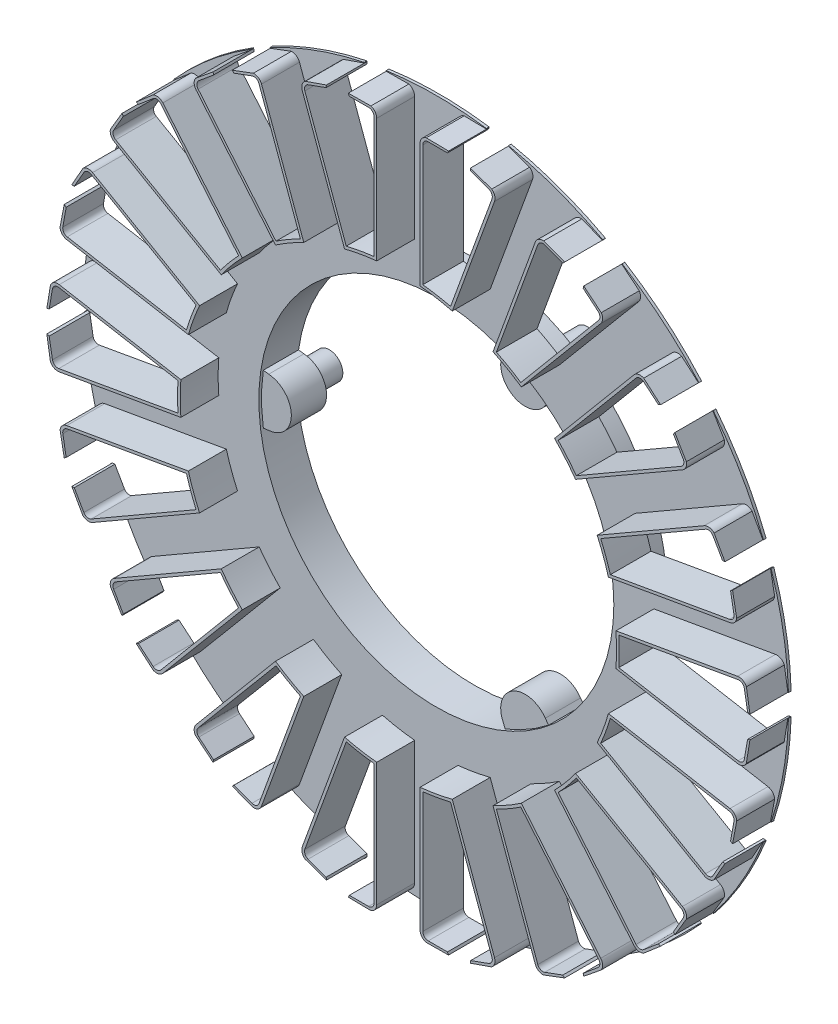
from build123d import *
from build123d.topology import SkipClean

# Parameters (mm, degrees)
SKETCH1_R            = 32.75
BOSS_EXTRUDE2_DEPTH  = 0.5
BOSS_EXTRUDE4_DEPTH  = 7
BOSS_EXTRUDE8_DEPTH  = 7
BOSS_EXTRUDE10_START = 6.5
SKETCH10_R           = 35.55
BOSS_EXTRUDE10_DEPTH = 6.5
SKETCH11_R           = 2.5
BOSS_EXTRUDE11_DEPTH = 5
SKETCH12_R           = 1.25
CUT_EXTRUDE1_DEPTH   = 10


with BuildPart() as part:
    # Sketch1 → Boss-Extrude2 (new body)
    with BuildSketch(Plane.XY):
        with BuildLine():
            Line((-4.5, 40.500771598), (-4.5, 62.839847339))
            ThreePointArc((-4.5, 62.839847339), (-4.793512909, 63.547573268), (-5.50175198, 63.839845805))
            Line((-5.50175198, 63.839845805), (-9.050000307, 63.833629334))
            Line((-9.050000307, 63.833629334), (-9.25, 64.233278938))
            Line((-9.25, 64.233278938), (-9.25, 64.338460504))
            ThreePointArc((-9.25, 64.338460504), (0, 65), (9.25, 64.338460504))
            Line((9.25, 64.338460504), (9.25, 64.233278938))
            Line((9.25, 64.233278938), (9.050000307, 63.833629334))
            Line((9.050000307, 63.833629334), (5.50175198, 63.839845805))
            ThreePointArc((5.50175198, 63.839845805), (4.793512909, 63.547573268), (4.5, 62.839847339))
            Line((4.5, 62.839847339), (4.5, 40.500771598))
            ThreePointArc((4.5, 40.500771598), (7.07616324, 40.130915935), (9.623462913, 39.597366851))
            Line((9.623462913, 39.597366851), (17.2638768, 60.589231481))
            ThreePointArc((17.2638768, 60.589231481), (17.230121409, 61.354663641), (16.664557475, 61.871542016))
            Line((16.664557475, 61.871542016), (13.328168547, 63.079272845))
            Line((13.328168547, 63.079272845), (13.276918526, 63.523224553))
            Line((13.276918526, 63.523224553), (13.312892741, 63.622062894))
            ThreePointArc((13.312892741, 63.622062894), (22.231309316, 61.080020351), (30.697206225, 57.294690242))
            Line((30.697206225, 57.294690242), (30.661232011, 57.195851901))
            Line((30.661232011, 57.195851901), (30.33660556, 56.888708041))
            Line((30.33660556, 56.888708041), (27.004468949, 58.108122014))
            ThreePointArc((27.004468949, 58.108122014), (26.238978825, 58.075707697), (25.721110387, 57.511050191))
            Line((25.721110387, 57.511050191), (18.0806965, 36.519185561))
            ThreePointArc((18.0806965, 36.519185561), (20.375, 35.290535204), (22.586194172, 33.917935268))
            Line((22.586194172, 33.917935268), (36.94547527, 51.030660104))
            ThreePointArc((36.94547527, 51.030660104), (37.175548796, 51.76147608), (36.820875356, 52.440617133))
            Line((36.820875356, 52.440617133), (34.098763572, 54.716625101))
            Line((34.098763572, 54.716625101), (34.202444732, 55.151331784))
            Line((34.202444732, 55.151331784), (34.270054139, 55.231905537))
            ThreePointArc((34.270054139, 55.231905537), (41.78119463, 49.792888803), (48.441876337, 43.340334758))
            Line((48.441876337, 43.340334758), (48.37426693, 43.259761004))
            Line((48.37426693, 43.259761004), (47.964168463, 43.082168971))
            Line((47.964168463, 43.082168971), (45.250048419, 45.367701124))
            ThreePointArc((45.250048419, 45.367701124), (44.519636649, 45.599054671), (43.839875258, 45.245571617))
            Line((43.839875258, 45.245571617), (29.48059416, 28.132846781))
            ThreePointArc((29.48059416, 28.132846781), (31.216311057, 26.193595095), (32.824697076, 24.147500116))
            Line((32.824697076, 24.147500116), (52.170904166, 35.317037987))
            ThreePointArc((52.170904166, 35.317037987), (52.637056345, 35.925090587), (52.53605225, 36.684579883))
            Line((52.53605225, 36.684579883), (50.756544466, 39.754344837))
            Line((50.756544466, 39.754344837), (51.002651329, 40.127374454))
            Line((51.002651329, 40.127374454), (51.093741237, 40.179965237))
            ThreePointArc((51.093741237, 40.179965237), (56.291651246, 32.5), (60.343741237, 24.158495267))
            Line((60.343741237, 24.158495267), (60.252651329, 24.105904484))
            Line((60.252651329, 24.105904484), (59.806544773, 24.079284497))
            Line((59.806544773, 24.079284497), (58.037804231, 27.155265922))
            ThreePointArc((58.037804231, 27.155265922), (57.430569254, 27.622482682), (56.670904166, 27.522809353))
            Line((56.670904166, 27.522809353), (37.324697076, 16.353271482))
            ThreePointArc((37.324697076, 16.353271482), (38.292474297, 13.937320841), (39.104057073, 11.464520071))
            Line((39.104057073, 11.464520071), (61.103752059, 15.343659864))
            ThreePointArc((61.103752059, 15.343659864), (61.749758058, 15.75560897), (61.914605894, 16.503840892))
            Line((61.914605894, 16.503840892), (61.29233701, 19.997103875))
            Line((61.29233701, 19.997103875), (61.651185456, 20.263463549))
            Line((61.651185456, 20.263463549), (61.754769078, 20.281728136))
            ThreePointArc((61.754769078, 20.281728136), (64.012503946, 11.287131548), (64.967260364, 2.062784705))
            Line((64.967260364, 2.062784705), (64.863676743, 2.044520118))
            Line((64.863676743, 2.044520118), (64.435369132, 2.172082941))
            Line((64.435369132, 2.172082941), (63.825344305, 5.667504881))
            ThreePointArc((63.825344305, 5.667504881), (63.414527621, 6.314231616), (62.666585658, 6.480390087))
            Line((62.666585658, 6.480390087), (40.666890672, 2.601250293))
            ThreePointArc((40.666890672, 2.601250293), (40.75, 0), (40.666890672, -2.601250293))
            Line((40.666890672, -2.601250293), (62.666585658, -6.480390087))
            ThreePointArc((62.666585658, -6.480390087), (63.414527621, -6.314231616), (63.825344305, -5.667504881))
            Line((63.825344305, -5.667504881), (64.435369132, -2.172082941))
            Line((64.435369132, -2.172082941), (64.863676743, -2.044520118))
            Line((64.863676743, -2.044520118), (64.967260364, -2.062784705))
            ThreePointArc((64.967260364, -2.062784705), (64.012503946, -11.287131548), (61.754769078, -20.281728136))
            Line((61.754769078, -20.281728136), (61.651185456, -20.263463549))
            Line((61.651185456, -20.263463549), (61.29233701, -19.997103875))
            Line((61.29233701, -19.997103875), (61.914605894, -16.503840892))
            ThreePointArc((61.914605894, -16.503840892), (61.749758058, -15.75560897), (61.103752059, -15.343659864))
            Line((61.103752059, -15.343659864), (39.104057073, -11.464520071))
            ThreePointArc((39.104057073, -11.464520071), (38.292474297, -13.937320841), (37.324697076, -16.353271482))
            Line((37.324697076, -16.353271482), (56.670904166, -27.522809353))
            ThreePointArc((56.670904166, -27.522809353), (57.430569254, -27.622482682), (58.037804231, -27.155265922))
            Line((58.037804231, -27.155265922), (59.806544773, -24.079284497))
            Line((59.806544773, -24.079284497), (60.252651329, -24.105904484))
            Line((60.252651329, -24.105904484), (60.343741237, -24.158495267))
            ThreePointArc((60.343741237, -24.158495267), (56.291651246, -32.5), (51.093741237, -40.179965237))
            Line((51.093741237, -40.179965237), (51.002651329, -40.127374454))
            Line((51.002651329, -40.127374454), (50.756544466, -39.754344837))
            Line((50.756544466, -39.754344837), (52.53605225, -36.684579883))
            ThreePointArc((52.53605225, -36.684579883), (52.637056345, -35.925090587), (52.170904166, -35.317037987))
            Line((52.170904166, -35.317037987), (32.824697076, -24.147500116))
            ThreePointArc((32.824697076, -24.147500116), (31.216311057, -26.193595095), (29.48059416, -28.132846781))
            Line((29.48059416, -28.132846781), (43.839875258, -45.245571617))
            ThreePointArc((43.839875258, -45.245571617), (44.519636649, -45.599054671), (45.250048419, -45.367701124))
            Line((45.250048419, -45.367701124), (47.964168463, -43.082168971))
            Line((47.964168463, -43.082168971), (48.37426693, -43.259761004))
            Line((48.37426693, -43.259761004), (48.441876337, -43.340334758))
            ThreePointArc((48.441876337, -43.340334758), (41.78119463, -49.792888803), (34.270054139, -55.231905537))
            Line((34.270054139, -55.231905537), (34.202444732, -55.151331784))
            Line((34.202444732, -55.151331784), (34.098763572, -54.716625101))
            Line((34.098763572, -54.716625101), (36.820875356, -52.440617133))
            ThreePointArc((36.820875356, -52.440617133), (37.175548796, -51.76147608), (36.94547527, -51.030660104))
            Line((36.94547527, -51.030660104), (22.586194172, -33.917935268))
            ThreePointArc((22.586194172, -33.917935268), (20.375, -35.290535204), (18.0806965, -36.519185561))
            Line((18.0806965, -36.519185561), (25.721110387, -57.511050191))
            ThreePointArc((25.721110387, -57.511050191), (26.238978825, -58.075707697), (27.004468949, -58.108122014))
            Line((27.004468949, -58.108122014), (30.33660556, -56.888708041))
            Line((30.33660556, -56.888708041), (30.661232011, -57.195851901))
            Line((30.661232011, -57.195851901), (30.697206225, -57.294690242))
            ThreePointArc((30.697206225, -57.294690242), (22.231309316, -61.080020351), (13.312892741, -63.622062894))
            Line((13.312892741, -63.622062894), (13.276918526, -63.523224553))
            Line((13.276918526, -63.523224553), (13.328168547, -63.079272845))
            Line((13.328168547, -63.079272845), (16.664557475, -61.871542016))
            ThreePointArc((16.664557475, -61.871542016), (17.230121409, -61.354663641), (17.2638768, -60.589231481))
            Line((17.2638768, -60.589231481), (9.623462913, -39.597366851))
            ThreePointArc((9.623462913, -39.597366851), (7.07616324, -40.130915935), (4.5, -40.500771598))
            Line((4.5, -40.500771598), (4.5, -62.839847339))
            ThreePointArc((4.5, -62.839847339), (4.793512909, -63.547573268), (5.50175198, -63.839845805))
            Line((5.50175198, -63.839845805), (9.050000307, -63.833629334))
            Line((9.050000307, -63.833629334), (9.25, -64.233278938))
            Line((9.25, -64.233278938), (9.25, -64.338460504))
            ThreePointArc((9.25, -64.338460504), (0, -65), (-9.25, -64.338460504))
            Line((-9.25, -64.338460504), (-9.25, -64.233278938))
            Line((-9.25, -64.233278938), (-9.050000307, -63.833629334))
            Line((-9.050000307, -63.833629334), (-5.50175198, -63.839845805))
            ThreePointArc((-5.50175198, -63.839845805), (-4.793512909, -63.547573268), (-4.5, -62.839847339))
            Line((-4.5, -62.839847339), (-4.5, -40.500771598))
            ThreePointArc((-4.5, -40.500771598), (-7.07616324, -40.130915935), (-9.623462913, -39.597366851))
            Line((-9.623462913, -39.597366851), (-17.2638768, -60.589231481))
            ThreePointArc((-17.2638768, -60.589231481), (-17.230121409, -61.354663641), (-16.664557475, -61.871542016))
            Line((-16.664557475, -61.871542016), (-13.328168547, -63.079272845))
            Line((-13.328168547, -63.079272845), (-13.276918526, -63.523224553))
            Line((-13.276918526, -63.523224553), (-13.312892741, -63.622062894))
            ThreePointArc((-13.312892741, -63.622062894), (-22.231309316, -61.080020351), (-30.697206225, -57.294690242))
            Line((-30.697206225, -57.294690242), (-30.661232011, -57.195851901))
            Line((-30.661232011, -57.195851901), (-30.33660556, -56.888708041))
            Line((-30.33660556, -56.888708041), (-27.004468949, -58.108122014))
            ThreePointArc((-27.004468949, -58.108122014), (-26.238978825, -58.075707697), (-25.721110387, -57.511050191))
            Line((-25.721110387, -57.511050191), (-18.0806965, -36.519185561))
            ThreePointArc((-18.0806965, -36.519185561), (-20.375, -35.290535204), (-22.586194172, -33.917935268))
            Line((-22.586194172, -33.917935268), (-36.94547527, -51.030660104))
            ThreePointArc((-36.94547527, -51.030660104), (-37.175548796, -51.76147608), (-36.820875356, -52.440617133))
            Line((-36.820875356, -52.440617133), (-34.098763572, -54.716625101))
            Line((-34.098763572, -54.716625101), (-34.202444732, -55.151331784))
            Line((-34.202444732, -55.151331784), (-34.270054139, -55.231905537))
            ThreePointArc((-34.270054139, -55.231905537), (-41.78119463, -49.792888803), (-48.441876337, -43.340334758))
            Line((-48.441876337, -43.340334758), (-48.37426693, -43.259761004))
            Line((-48.37426693, -43.259761004), (-47.964168463, -43.082168971))
            Line((-47.964168463, -43.082168971), (-45.250048419, -45.367701124))
            ThreePointArc((-45.250048419, -45.367701124), (-44.519636649, -45.599054671), (-43.839875258, -45.245571617))
            Line((-43.839875258, -45.245571617), (-29.48059416, -28.132846781))
            ThreePointArc((-29.48059416, -28.132846781), (-31.216311057, -26.193595095), (-32.824697076, -24.147500116))
            Line((-32.824697076, -24.147500116), (-52.170904166, -35.317037987))
            ThreePointArc((-52.170904166, -35.317037987), (-52.637056345, -35.925090587), (-52.53605225, -36.684579883))
            Line((-52.53605225, -36.684579883), (-50.756544466, -39.754344837))
            Line((-50.756544466, -39.754344837), (-51.002651329, -40.127374454))
            Line((-51.002651329, -40.127374454), (-51.093741237, -40.179965237))
            ThreePointArc((-51.093741237, -40.179965237), (-56.291651246, -32.5), (-60.343741237, -24.158495267))
            Line((-60.343741237, -24.158495267), (-60.252651329, -24.105904484))
            Line((-60.252651329, -24.105904484), (-59.806544773, -24.079284497))
            Line((-59.806544773, -24.079284497), (-58.037804231, -27.155265922))
            ThreePointArc((-58.037804231, -27.155265922), (-57.430569254, -27.622482682), (-56.670904166, -27.522809353))
            Line((-56.670904166, -27.522809353), (-37.324697076, -16.353271482))
            ThreePointArc((-37.324697076, -16.353271482), (-38.292474297, -13.937320841), (-39.104057073, -11.464520071))
            Line((-39.104057073, -11.464520071), (-61.103752059, -15.343659864))
            ThreePointArc((-61.103752059, -15.343659864), (-61.749758058, -15.75560897), (-61.914605894, -16.503840892))
            Line((-61.914605894, -16.503840892), (-61.29233701, -19.997103875))
            Line((-61.29233701, -19.997103875), (-61.651185456, -20.263463549))
            Line((-61.651185456, -20.263463549), (-61.754769078, -20.281728136))
            ThreePointArc((-61.754769078, -20.281728136), (-64.012503946, -11.287131548), (-64.967260364, -2.062784705))
            Line((-64.967260364, -2.062784705), (-64.863676743, -2.044520118))
            Line((-64.863676743, -2.044520118), (-64.435369132, -2.172082941))
            Line((-64.435369132, -2.172082941), (-63.825344305, -5.667504881))
            ThreePointArc((-63.825344305, -5.667504881), (-63.414527621, -6.314231616), (-62.666585658, -6.480390087))
            Line((-62.666585658, -6.480390087), (-40.666890672, -2.601250293))
            ThreePointArc((-40.666890672, -2.601250293), (-40.75, 0), (-40.666890672, 2.601250293))
            Line((-40.666890672, 2.601250293), (-62.666585658, 6.480390087))
            ThreePointArc((-62.666585658, 6.480390087), (-63.414527621, 6.314231616), (-63.825344305, 5.667504881))
            Line((-63.825344305, 5.667504881), (-64.435369132, 2.172082941))
            Line((-64.435369132, 2.172082941), (-64.863676743, 2.044520118))
            Line((-64.863676743, 2.044520118), (-64.967260364, 2.062784705))
            ThreePointArc((-64.967260364, 2.062784705), (-64.012503946, 11.287131548), (-61.754769078, 20.281728136))
            Line((-61.754769078, 20.281728136), (-61.651185456, 20.263463549))
            Line((-61.651185456, 20.263463549), (-61.29233701, 19.997103875))
            Line((-61.29233701, 19.997103875), (-61.914605894, 16.503840892))
            ThreePointArc((-61.914605894, 16.503840892), (-61.749758058, 15.75560897), (-61.103752059, 15.343659864))
            Line((-61.103752059, 15.343659864), (-39.104057073, 11.464520071))
            ThreePointArc((-39.104057073, 11.464520071), (-38.292474297, 13.937320841), (-37.324697076, 16.353271482))
            Line((-37.324697076, 16.353271482), (-56.670904166, 27.522809353))
            ThreePointArc((-56.670904166, 27.522809353), (-57.430569254, 27.622482682), (-58.037804231, 27.155265922))
            Line((-58.037804231, 27.155265922), (-59.806544773, 24.079284497))
            Line((-59.806544773, 24.079284497), (-60.252651329, 24.105904484))
            Line((-60.252651329, 24.105904484), (-60.343741237, 24.158495267))
            ThreePointArc((-60.343741237, 24.158495267), (-56.291651246, 32.5), (-51.093741237, 40.179965237))
            Line((-51.093741237, 40.179965237), (-51.002651329, 40.127374454))
            Line((-51.002651329, 40.127374454), (-50.756544466, 39.754344837))
            Line((-50.756544466, 39.754344837), (-52.53605225, 36.684579883))
            ThreePointArc((-52.53605225, 36.684579883), (-52.637056345, 35.925090587), (-52.170904166, 35.317037987))
            Line((-52.170904166, 35.317037987), (-32.824697076, 24.147500116))
            ThreePointArc((-32.824697076, 24.147500116), (-31.216311057, 26.193595095), (-29.48059416, 28.132846781))
            Line((-29.48059416, 28.132846781), (-43.839875258, 45.245571617))
            ThreePointArc((-43.839875258, 45.245571617), (-44.519636649, 45.599054671), (-45.250048419, 45.367701124))
            Line((-45.250048419, 45.367701124), (-47.964168463, 43.082168971))
            Line((-47.964168463, 43.082168971), (-48.37426693, 43.259761004))
            Line((-48.37426693, 43.259761004), (-48.441876337, 43.340334758))
            ThreePointArc((-48.441876337, 43.340334758), (-41.78119463, 49.792888803), (-34.270054139, 55.231905537))
            Line((-34.270054139, 55.231905537), (-34.202444732, 55.151331784))
            Line((-34.202444732, 55.151331784), (-34.098763572, 54.716625101))
            Line((-34.098763572, 54.716625101), (-36.820875356, 52.440617133))
            ThreePointArc((-36.820875356, 52.440617133), (-37.175548796, 51.76147608), (-36.94547527, 51.030660104))
            Line((-36.94547527, 51.030660104), (-22.586194172, 33.917935268))
            ThreePointArc((-22.586194172, 33.917935268), (-20.375, 35.290535204), (-18.0806965, 36.519185561))
            Line((-18.0806965, 36.519185561), (-25.721110387, 57.511050191))
            ThreePointArc((-25.721110387, 57.511050191), (-26.238978825, 58.075707697), (-27.004468949, 58.108122014))
            Line((-27.004468949, 58.108122014), (-30.33660556, 56.888708041))
            Line((-30.33660556, 56.888708041), (-30.661232011, 57.195851901))
            Line((-30.661232011, 57.195851901), (-30.697206225, 57.294690242))
            ThreePointArc((-30.697206225, 57.294690242), (-22.231309316, 61.080020351), (-13.312892741, 63.622062894))
            Line((-13.312892741, 63.622062894), (-13.276918526, 63.523224553))
            Line((-13.276918526, 63.523224553), (-13.328168547, 63.079272845))
            Line((-13.328168547, 63.079272845), (-16.664557475, 61.871542016))
            ThreePointArc((-16.664557475, 61.871542016), (-17.230121409, 61.354663641), (-17.2638768, 60.589231481))
            Line((-17.2638768, 60.589231481), (-9.623462913, 39.597366851))
            ThreePointArc((-9.623462913, 39.597366851), (-7.07616324, 40.130915935), (-4.5, 40.500771598))
        make_face()
        Circle(SKETCH1_R, mode=Mode.SUBTRACT)
    extrude(amount=BOSS_EXTRUDE2_DEPTH)

    # Sketch3 → Boss-Extrude4 (add)
    with BuildSketch(Plane.XY.offset(0.5)):
        with BuildLine():
            Line((-60.252651329, 24.105904484), (-59.806544773, 24.079284497))
            Line((-59.806544773, 24.079284497), (-58.037804231, 27.155265922))
            ThreePointArc((-58.037804231, 27.155265922), (-57.430569254, 27.622482682), (-56.670904166, 27.522809353))
            Line((-56.670904166, 27.522809353), (-37.324697076, 16.353271482))
            ThreePointArc((-37.324697076, 16.353271482), (-38.292474297, 13.937320841), (-39.104057073, 11.464520071))
            Line((-39.104057073, 11.464520071), (-61.103752059, 15.343659864))
            ThreePointArc((-61.103752059, 15.343659864), (-61.749758058, 15.75560897), (-61.914605894, 16.503840892))
            Line((-61.914605894, 16.503840892), (-61.29233701, 19.997103875))
            Line((-61.29233701, 19.997103875), (-61.651185456, 20.263463549))
            Line((-61.651185456, 20.263463549), (-62.426408414, 16.223240507))
            ThreePointArc((-62.426408414, 16.223240507), (-62.044622414, 15.324551067), (-61.190576147, 14.851255987))
            Line((-61.190576147, 14.851255987), (-38.747695474, 10.8939706))
            ThreePointArc((-38.747695474, 10.8939706), (-37.822627987, 13.766310769), (-36.684966124, 16.561272913))
            Line((-36.684966124, 16.561272913), (-56.420904166, 27.955822055))
            ThreePointArc((-56.420904166, 27.955822055), (-57.345465081, 28.146592154), (-58.200883883, 27.747261726))
            Line((-58.200883883, 27.747261726), (-60.252651329, 24.105904484))
        make_face()
        with BuildLine():
            Line((-22.67994748, 33.251804196), (-37.328497492, 50.7092663))
            ThreePointArc((-37.328497492, 50.7092663), (-37.678506676, 51.620801724), (-37.393305282, 52.554645086))
            Line((-37.393305282, 52.554645086), (-34.202444732, 55.151331784))
            Line((-34.202444732, 55.151331784), (-34.098763572, 54.716625101))
            Line((-34.098763572, 54.716625101), (-36.820875356, 52.440617133))
            ThreePointArc((-36.820875356, 52.440617133), (-37.175548796, 51.76147608), (-36.94547527, 51.030660104))
            Line((-36.94547527, 51.030660104), (-22.586194172, 33.917935268))
            ThreePointArc((-22.586194172, 33.917935268), (-20.375, 35.290535204), (-18.0806965, 36.519185561))
            Line((-18.0806965, 36.519185561), (-25.721110387, 57.511050191))
            ThreePointArc((-25.721110387, 57.511050191), (-26.238978825, 58.075707697), (-27.004468949, 58.108122014))
            Line((-27.004468949, 58.108122014), (-30.33660556, 56.888708041))
            Line((-30.33660556, 56.888708041), (-30.661232011, 57.195851901))
            Line((-30.661232011, 57.195851901), (-26.748867643, 58.66644269))
            ThreePointArc((-26.748867643, 58.66644269), (-25.836894172, 58.422494938), (-25.251264077, 57.682060263))
            Line((-25.251264077, 57.682060263), (-17.456933416, 36.267312772))
            ThreePointArc((-17.456933416, 36.267312772), (-20.125, 34.857522502), (-22.67994748, 33.251804196))
        make_face()
        with BuildLine():
            Line((-9.93939245, 39.003473919), (-17.73372311, 60.41822141))
            ThreePointArc((-17.73372311, 60.41822141), (-17.750860681, 61.394494713), (-17.163465796, 62.174475807))
            Line((-17.163465796, 62.174475807), (-13.276918526, 63.523224553))
            Line((-13.276918526, 63.523224553), (-13.328168547, 63.079272845))
            Line((-13.328168547, 63.079272845), (-16.664557475, 61.871542016))
            ThreePointArc((-16.664557475, 61.871542016), (-17.230121409, 61.354663641), (-17.2638768, 60.589231481))
            Line((-17.2638768, 60.589231481), (-9.623462913, 39.597366851))
            ThreePointArc((-9.623462913, 39.597366851), (-7.07616324, 40.130915935), (-4.5, 40.500771598))
            Line((-4.5, 40.500771598), (-4.5, 62.839847339))
            ThreePointArc((-4.5, 62.839847339), (-4.793512909, 63.547573268), (-5.50175198, 63.839845805))
            Line((-5.50175198, 63.839845805), (-9.050000307, 63.833629334))
            Line((-9.050000307, 63.833629334), (-9.25, 64.233278938))
            Line((-9.25, 64.233278938), (-5.070608402, 64.277074828))
            ThreePointArc((-5.070608402, 64.277074828), (-4.297068706, 63.735925629), (-4, 62.839847339))
            Line((-4, 62.839847339), (-4, 40.050749057))
            ThreePointArc((-4, 40.050749057), (-6.989339151, 39.638512059), (-9.93939245, 39.003473919))
        make_face()
        with BuildLine():
            Line((4, 40.050749057), (4, 62.839847339))
            ThreePointArc((4, 62.839847339), (4.317801086, 63.763105553), (5.136540971, 64.295147149))
            Line((5.136540971, 64.295147149), (9.25, 64.233278938))
            Line((9.25, 64.233278938), (9.050000307, 63.833629334))
            Line((9.050000307, 63.833629334), (5.50175198, 63.839845805))
            ThreePointArc((5.50175198, 63.839845805), (4.793512909, 63.547573268), (4.5, 62.839847339))
            Line((4.5, 62.839847339), (4.5, 40.500771598))
            ThreePointArc((4.5, 40.500771598), (7.07616324, 40.130915935), (9.623462913, 39.597366851))
            Line((9.623462913, 39.597366851), (17.2638768, 60.589231481))
            ThreePointArc((17.2638768, 60.589231481), (17.230121409, 61.354663641), (16.664557475, 61.871542016))
            Line((16.664557475, 61.871542016), (13.328168547, 63.079272845))
            Line((13.328168547, 63.079272845), (13.276918526, 63.523224553))
            Line((13.276918526, 63.523224553), (17.219241048, 62.134943114))
            ThreePointArc((17.219241048, 62.134943114), (17.761046665, 61.361863047), (17.73372311, 60.41822141))
            Line((17.73372311, 60.41822141), (9.93939245, 39.003473919))
            ThreePointArc((9.93939245, 39.003473919), (6.989339151, 39.638512059), (4, 40.050749057))
        make_face()
        with BuildLine():
            Line((17.456933416, 36.267312772), (25.251264077, 57.682060263))
            ThreePointArc((25.251264077, 57.682060263), (25.865672319, 58.44094482), (26.81700509, 58.660874849))
            Line((26.81700509, 58.660874849), (30.661232011, 57.195851901))
            Line((30.661232011, 57.195851901), (30.33660556, 56.888708041))
            Line((30.33660556, 56.888708041), (27.004468949, 58.108122014))
            ThreePointArc((27.004468949, 58.108122014), (26.238978825, 58.075707697), (25.721110387, 57.511050191))
            Line((25.721110387, 57.511050191), (18.0806965, 36.519185561))
            ThreePointArc((18.0806965, 36.519185561), (20.375, 35.290535204), (22.586194172, 33.917935268))
            Line((22.586194172, 33.917935268), (36.94547527, 51.030660104))
            ThreePointArc((36.94547527, 51.030660104), (37.175548796, 51.76147608), (36.820875356, 52.440617133))
            Line((36.820875356, 52.440617133), (34.098763572, 54.716625101))
            Line((34.098763572, 54.716625101), (34.202444732, 55.151331784))
            Line((34.202444732, 55.151331784), (37.432195897, 52.498420246))
            ThreePointArc((37.432195897, 52.498420246), (37.676917683, 51.586654177), (37.328497492, 50.7092663))
            Line((37.328497492, 50.7092663), (22.67994748, 33.251804196))
            ThreePointArc((22.67994748, 33.251804196), (20.125, 34.857522502), (17.456933416, 36.267312772))
        make_face()
        with BuildLine():
            Line((28.808303025, 28.109503319), (43.456853037, 45.566965422))
            ThreePointArc((43.456853037, 45.566965422), (44.293761733, 46.069943645), (45.262942618, 45.9512353))
            Line((45.262942618, 45.9512353), (48.37426693, 43.259761004))
            Line((48.37426693, 43.259761004), (47.964168463, 43.082168971))
            Line((47.964168463, 43.082168971), (45.250048419, 45.367701124))
            ThreePointArc((45.250048419, 45.367701124), (44.519636649, 45.599054671), (43.839875258, 45.245571617))
            Line((43.839875258, 45.245571617), (29.48059416, 28.132846781))
            ThreePointArc((29.48059416, 28.132846781), (31.216311057, 26.193595095), (32.824697076, 24.147500116))
            Line((32.824697076, 24.147500116), (52.170904166, 35.317037987))
            ThreePointArc((52.170904166, 35.317037987), (52.637056345, 35.925090587), (52.53605225, 36.684579883))
            Line((52.53605225, 36.684579883), (50.756544466, 39.754344837))
            Line((50.756544466, 39.754344837), (51.002651329, 40.127374454))
            Line((51.002651329, 40.127374454), (53.130275482, 36.529813103))
            ThreePointArc((53.130275482, 36.529813103), (53.048396376, 35.589333475), (52.420904166, 34.884025285))
            Line((52.420904166, 34.884025285), (32.684966124, 23.489476143))
            ThreePointArc((32.684966124, 23.489476143), (30.833288836, 25.87220129), (28.808303025, 28.109503319))
        make_face()
        with BuildLine():
            Line((36.684966124, 16.561272913), (56.420904166, 27.955822055))
            ThreePointArc((56.420904166, 27.955822055), (57.379369776, 28.142227347), (58.249501256, 27.699198606))
            Line((58.249501256, 27.699198606), (60.252651329, 24.105904484))
            Line((60.252651329, 24.105904484), (59.806544773, 24.079284497))
            Line((59.806544773, 24.079284497), (58.037804231, 27.155265922))
            ThreePointArc((58.037804231, 27.155265922), (57.430569254, 27.622482682), (56.670904166, 27.522809353))
            Line((56.670904166, 27.522809353), (37.324697076, 16.353271482))
            ThreePointArc((37.324697076, 16.353271482), (38.292474297, 13.937320841), (39.104057073, 11.464520071))
            Line((39.104057073, 11.464520071), (61.103752059, 15.343659864))
            ThreePointArc((61.103752059, 15.343659864), (61.749758058, 15.75560897), (61.914605894, 16.503840892))
            Line((61.914605894, 16.503840892), (61.29233701, 19.997103875))
            Line((61.29233701, 19.997103875), (61.651185456, 20.263463549))
            Line((61.651185456, 20.263463549), (62.420059723, 16.155171376))
            ThreePointArc((62.420059723, 16.155171376), (62.021455555, 15.299413914), (61.190576147, 14.851255987))
            Line((61.190576147, 14.851255987), (38.747695474, 10.8939706))
            ThreePointArc((38.747695474, 10.8939706), (37.822627987, 13.766310769), (36.684966124, 16.561272913))
        make_face()
        with BuildLine():
            Line((40.136880896, 3.015508576), (62.579761569, 6.972793963))
            ThreePointArc((62.579761569, 6.972793963), (63.544178995, 6.820143096), (64.210310372, 6.106229763))
            Line((64.210310372, 6.106229763), (64.863676743, 2.044520118))
            Line((64.863676743, 2.044520118), (64.435369132, 2.172082941))
            Line((64.435369132, 2.172082941), (63.825344305, 5.667504881))
            ThreePointArc((63.825344305, 5.667504881), (63.414527621, 6.314231616), (62.666585658, 6.480390087))
            Line((62.666585658, 6.480390087), (40.666890672, 2.601250293))
            ThreePointArc((40.666890672, 2.601250293), (40.75, 0), (40.666890672, -2.601250293))
            Line((40.666890672, -2.601250293), (62.666585658, -6.480390087))
            ThreePointArc((62.666585658, -6.480390087), (63.414527621, -6.314231616), (63.825344305, -5.667504881))
            Line((63.825344305, -5.667504881), (64.435369132, -2.172082941))
            Line((64.435369132, -2.172082941), (64.863676743, -2.044520118))
            Line((64.863676743, -2.044520118), (64.181063541, -6.168022443))
            ThreePointArc((64.181063541, -6.168022443), (63.513811855, -6.835840761), (62.579761569, -6.972793963))
            Line((62.579761569, -6.972793963), (40.136880896, -3.015508576))
            ThreePointArc((40.136880896, -3.015508576), (40.25, 0), (40.136880896, 3.015508576))
        make_face()
        with BuildLine():
            Line((38.747695474, -10.8939706), (61.190576147, -14.851255987))
            ThreePointArc((61.190576147, -14.851255987), (62.044622414, -15.324551067), (62.426408414, -16.223240507))
            Line((62.426408414, -16.223240507), (61.651185456, -20.263463549))
            Line((61.651185456, -20.263463549), (61.29233701, -19.997103875))
            Line((61.29233701, -19.997103875), (61.914605894, -16.503840892))
            ThreePointArc((61.914605894, -16.503840892), (61.749758058, -15.75560897), (61.103752059, -15.343659864))
            Line((61.103752059, -15.343659864), (39.104057073, -11.464520071))
            ThreePointArc((39.104057073, -11.464520071), (38.292474297, -13.937320841), (37.324697076, -16.353271482))
            Line((37.324697076, -16.353271482), (56.670904166, -27.522809353))
            ThreePointArc((56.670904166, -27.522809353), (57.430569254, -27.622482682), (58.037804231, -27.155265922))
            Line((58.037804231, -27.155265922), (59.806544773, -24.079284497))
            Line((59.806544773, -24.079284497), (60.252651329, -24.105904484))
            Line((60.252651329, -24.105904484), (58.200883883, -27.747261726))
            ThreePointArc((58.200883883, -27.747261726), (57.345465081, -28.146592154), (56.420904166, -27.955822055))
            Line((56.420904166, -27.955822055), (36.684966124, -16.561272913))
            ThreePointArc((36.684966124, -16.561272913), (37.822627987, -13.766310769), (38.747695474, -10.8939706))
        make_face()
        with BuildLine():
            Line((32.684966124, -23.489476143), (52.420904166, -34.884025285))
            ThreePointArc((52.420904166, -34.884025285), (53.06156869, -35.620878206), (53.112960285, -36.595948543))
            Line((53.112960285, -36.595948543), (51.002651329, -40.127374454))
            Line((51.002651329, -40.127374454), (50.756544466, -39.754344837))
            Line((50.756544466, -39.754344837), (52.53605225, -36.684579883))
            ThreePointArc((52.53605225, -36.684579883), (52.637056345, -35.925090587), (52.170904166, -35.317037987))
            Line((52.170904166, -35.317037987), (32.824697076, -24.147500116))
            ThreePointArc((32.824697076, -24.147500116), (31.216311057, -26.193595095), (29.48059416, -28.132846781))
            Line((29.48059416, -28.132846781), (43.839875258, -45.245571617))
            ThreePointArc((43.839875258, -45.245571617), (44.519636649, -45.599054671), (45.250048419, -45.367701124))
            Line((45.250048419, -45.367701124), (47.964168463, -43.082168971))
            Line((47.964168463, -43.082168971), (48.37426693, -43.259761004))
            Line((48.37426693, -43.259761004), (45.200818676, -45.979771738))
            ThreePointArc((45.200818676, -45.979771738), (44.26040889, -46.062449133), (43.456853037, -45.566965422))
            Line((43.456853037, -45.566965422), (28.808303025, -28.109503319))
            ThreePointArc((28.808303025, -28.109503319), (30.833288836, -25.87220129), (32.684966124, -23.489476143))
        make_face()
        with BuildLine():
            Line((22.67994748, -33.251804196), (37.328497492, -50.7092663))
            ThreePointArc((37.328497492, -50.7092663), (37.678506676, -51.620801724), (37.393305282, -52.554645086))
            Line((37.393305282, -52.554645086), (34.202444732, -55.151331784))
            Line((34.202444732, -55.151331784), (34.098763572, -54.716625101))
            Line((34.098763572, -54.716625101), (36.820875356, -52.440617133))
            ThreePointArc((36.820875356, -52.440617133), (37.175548796, -51.76147608), (36.94547527, -51.030660104))
            Line((36.94547527, -51.030660104), (22.586194172, -33.917935268))
            ThreePointArc((22.586194172, -33.917935268), (20.375, -35.290535204), (18.0806965, -36.519185561))
            Line((18.0806965, -36.519185561), (25.721110387, -57.511050191))
            ThreePointArc((25.721110387, -57.511050191), (26.238978825, -58.075707697), (27.004468949, -58.108122014))
            Line((27.004468949, -58.108122014), (30.33660556, -56.888708041))
            Line((30.33660556, -56.888708041), (30.661232011, -57.195851901))
            Line((30.661232011, -57.195851901), (26.748867643, -58.66644269))
            ThreePointArc((26.748867643, -58.66644269), (25.836894172, -58.422494938), (25.251264077, -57.682060263))
            Line((25.251264077, -57.682060263), (17.456933416, -36.267312772))
            ThreePointArc((17.456933416, -36.267312772), (20.125, -34.857522502), (22.67994748, -33.251804196))
        make_face()
        with BuildLine():
            Line((9.93939245, -39.003473919), (17.73372311, -60.41822141))
            ThreePointArc((17.73372311, -60.41822141), (17.750860681, -61.394494713), (17.163465796, -62.174475807))
            Line((17.163465796, -62.174475807), (13.276918526, -63.523224553))
            Line((13.276918526, -63.523224553), (13.328168547, -63.079272845))
            Line((13.328168547, -63.079272845), (16.664557475, -61.871542016))
            ThreePointArc((16.664557475, -61.871542016), (17.230121409, -61.354663641), (17.2638768, -60.589231481))
            Line((17.2638768, -60.589231481), (9.623462913, -39.597366851))
            ThreePointArc((9.623462913, -39.597366851), (7.07616324, -40.130915935), (4.5, -40.500771598))
            Line((4.5, -40.500771598), (4.5, -62.839847339))
            ThreePointArc((4.5, -62.839847339), (4.793512909, -63.547573268), (5.50175198, -63.839845805))
            Line((5.50175198, -63.839845805), (9.050000307, -63.833629334))
            Line((9.050000307, -63.833629334), (9.25, -64.233278938))
            Line((9.25, -64.233278938), (5.070608402, -64.277074828))
            ThreePointArc((5.070608402, -64.277074828), (4.297068706, -63.735925629), (4, -62.839847339))
            Line((4, -62.839847339), (4, -40.050749057))
            ThreePointArc((4, -40.050749057), (6.989339151, -39.638512059), (9.93939245, -39.003473919))
        make_face()
        with BuildLine():
            Line((-4, -40.050749057), (-4, -62.839847339))
            ThreePointArc((-4, -62.839847339), (-4.317801086, -63.763105553), (-5.136540971, -64.295147149))
            Line((-5.136540971, -64.295147149), (-9.25, -64.233278938))
            Line((-9.25, -64.233278938), (-9.050000307, -63.833629334))
            Line((-9.050000307, -63.833629334), (-5.50175198, -63.839845805))
            ThreePointArc((-5.50175198, -63.839845805), (-4.793512909, -63.547573268), (-4.5, -62.839847339))
            Line((-4.5, -62.839847339), (-4.5, -40.500771598))
            ThreePointArc((-4.5, -40.500771598), (-7.07616324, -40.130915935), (-9.623462913, -39.597366851))
            Line((-9.623462913, -39.597366851), (-17.2638768, -60.589231481))
            ThreePointArc((-17.2638768, -60.589231481), (-17.230121409, -61.354663641), (-16.664557475, -61.871542016))
            Line((-16.664557475, -61.871542016), (-13.328168547, -63.079272845))
            Line((-13.328168547, -63.079272845), (-13.276918526, -63.523224553))
            Line((-13.276918526, -63.523224553), (-17.219241048, -62.134943114))
            ThreePointArc((-17.219241048, -62.134943114), (-17.761046665, -61.361863047), (-17.73372311, -60.41822141))
            Line((-17.73372311, -60.41822141), (-9.93939245, -39.003473919))
            ThreePointArc((-9.93939245, -39.003473919), (-6.989339151, -39.638512059), (-4, -40.050749057))
        make_face()
        with BuildLine():
            Line((-17.456933416, -36.267312772), (-25.251264077, -57.682060263))
            ThreePointArc((-25.251264077, -57.682060263), (-25.865672319, -58.44094482), (-26.81700509, -58.660874849))
            Line((-26.81700509, -58.660874849), (-30.661232011, -57.195851901))
            Line((-30.661232011, -57.195851901), (-30.33660556, -56.888708041))
            Line((-30.33660556, -56.888708041), (-27.004468949, -58.108122014))
            ThreePointArc((-27.004468949, -58.108122014), (-26.238978825, -58.075707697), (-25.721110387, -57.511050191))
            Line((-25.721110387, -57.511050191), (-18.0806965, -36.519185561))
            ThreePointArc((-18.0806965, -36.519185561), (-20.375, -35.290535204), (-22.586194172, -33.917935268))
            Line((-22.586194172, -33.917935268), (-36.94547527, -51.030660104))
            ThreePointArc((-36.94547527, -51.030660104), (-37.175548796, -51.76147608), (-36.820875356, -52.440617133))
            Line((-36.820875356, -52.440617133), (-34.098763572, -54.716625101))
            Line((-34.098763572, -54.716625101), (-34.202444732, -55.151331784))
            Line((-34.202444732, -55.151331784), (-37.432195897, -52.498420246))
            ThreePointArc((-37.432195897, -52.498420246), (-37.676917683, -51.586654177), (-37.328497492, -50.7092663))
            Line((-37.328497492, -50.7092663), (-22.67994748, -33.251804196))
            ThreePointArc((-22.67994748, -33.251804196), (-20.125, -34.857522502), (-17.456933416, -36.267312772))
        make_face()
        with BuildLine():
            Line((-28.808303025, -28.109503319), (-43.456853037, -45.566965422))
            ThreePointArc((-43.456853037, -45.566965422), (-44.293761733, -46.069943645), (-45.262942618, -45.9512353))
            Line((-45.262942618, -45.9512353), (-48.37426693, -43.259761004))
            Line((-48.37426693, -43.259761004), (-47.964168463, -43.082168971))
            Line((-47.964168463, -43.082168971), (-45.250048419, -45.367701124))
            ThreePointArc((-45.250048419, -45.367701124), (-44.519636649, -45.599054671), (-43.839875258, -45.245571617))
            Line((-43.839875258, -45.245571617), (-29.48059416, -28.132846781))
            ThreePointArc((-29.48059416, -28.132846781), (-31.216311057, -26.193595095), (-32.824697076, -24.147500116))
            Line((-32.824697076, -24.147500116), (-52.170904166, -35.317037987))
            ThreePointArc((-52.170904166, -35.317037987), (-52.637056345, -35.925090587), (-52.53605225, -36.684579883))
            Line((-52.53605225, -36.684579883), (-50.756544466, -39.754344837))
            Line((-50.756544466, -39.754344837), (-51.002651329, -40.127374454))
            Line((-51.002651329, -40.127374454), (-53.130275482, -36.529813103))
            ThreePointArc((-53.130275482, -36.529813103), (-53.048396376, -35.589333475), (-52.420904166, -34.884025285))
            Line((-52.420904166, -34.884025285), (-32.684966124, -23.489476143))
            ThreePointArc((-32.684966124, -23.489476143), (-30.833288836, -25.87220129), (-28.808303025, -28.109503319))
        make_face()
        with BuildLine():
            Line((-36.684966124, -16.561272913), (-56.420904166, -27.955822055))
            ThreePointArc((-56.420904166, -27.955822055), (-57.379369776, -28.142227347), (-58.249501256, -27.699198606))
            Line((-58.249501256, -27.699198606), (-60.252651329, -24.105904484))
            Line((-60.252651329, -24.105904484), (-59.806544773, -24.079284497))
            Line((-59.806544773, -24.079284497), (-58.037804231, -27.155265922))
            ThreePointArc((-58.037804231, -27.155265922), (-57.430569254, -27.622482682), (-56.670904166, -27.522809353))
            Line((-56.670904166, -27.522809353), (-37.324697076, -16.353271482))
            ThreePointArc((-37.324697076, -16.353271482), (-38.292474297, -13.937320841), (-39.104057073, -11.464520071))
            Line((-39.104057073, -11.464520071), (-61.103752059, -15.343659864))
            ThreePointArc((-61.103752059, -15.343659864), (-61.749758058, -15.75560897), (-61.914605894, -16.503840892))
            Line((-61.914605894, -16.503840892), (-61.29233701, -19.997103875))
            Line((-61.29233701, -19.997103875), (-61.651185456, -20.263463549))
            Line((-61.651185456, -20.263463549), (-62.420059723, -16.155171376))
            ThreePointArc((-62.420059723, -16.155171376), (-62.021455555, -15.299413914), (-61.190576147, -14.851255987))
            Line((-61.190576147, -14.851255987), (-38.747695474, -10.8939706))
            ThreePointArc((-38.747695474, -10.8939706), (-37.822627987, -13.766310769), (-36.684966124, -16.561272913))
        make_face()
        with BuildLine():
            Line((-40.136880896, -3.015508576), (-62.579761569, -6.972793963))
            ThreePointArc((-62.579761569, -6.972793963), (-63.544178995, -6.820143096), (-64.210310372, -6.106229763))
            Line((-64.210310372, -6.106229763), (-64.863676743, -2.044520118))
            Line((-64.863676743, -2.044520118), (-64.435369132, -2.172082941))
            Line((-64.435369132, -2.172082941), (-63.825344305, -5.667504881))
            ThreePointArc((-63.825344305, -5.667504881), (-63.414527621, -6.314231616), (-62.666585658, -6.480390087))
            Line((-62.666585658, -6.480390087), (-40.666890672, -2.601250293))
            ThreePointArc((-40.666890672, -2.601250293), (-40.75, 0), (-40.666890672, 2.601250293))
            Line((-40.666890672, 2.601250293), (-62.666585658, 6.480390087))
            ThreePointArc((-62.666585658, 6.480390087), (-63.414527621, 6.314231616), (-63.825344305, 5.667504881))
            Line((-63.825344305, 5.667504881), (-64.435369132, 2.172082941))
            Line((-64.435369132, 2.172082941), (-64.863676743, 2.044520118))
            Line((-64.863676743, 2.044520118), (-64.181063541, 6.168022443))
            ThreePointArc((-64.181063541, 6.168022443), (-63.513811855, 6.835840761), (-62.579761569, 6.972793963))
            Line((-62.579761569, 6.972793963), (-40.136880896, 3.015508576))
            ThreePointArc((-40.136880896, 3.015508576), (-40.25, 0), (-40.136880896, -3.015508576))
        make_face()
    extrude(amount=BOSS_EXTRUDE4_DEPTH)

    # Sketch8 → Boss-Extrude8 (add)
    with BuildSketch(Plane.XY.offset(0.5)):
        with BuildLine():
            Line((-43.839875258, 45.245571617), (-29.48059416, 28.132846781))
            ThreePointArc((-29.48059416, 28.132846781), (-31.216311057, 26.193595095), (-32.824697076, 24.147500116))
            Line((-32.824697076, 24.147500116), (-52.170904166, 35.317037987))
            ThreePointArc((-52.170904166, 35.317037987), (-52.637056345, 35.925090587), (-52.53605225, 36.684579883))
            Line((-52.53605225, 36.684579883), (-50.756544466, 39.754344837))
            Line((-50.756544466, 39.754344837), (-51.002651329, 40.127374454))
            Line((-51.002651329, 40.127374454), (-53.130275482, 36.529813103))
            ThreePointArc((-53.130275482, 36.529813103), (-53.048396376, 35.589333475), (-52.420904166, 34.884025285))
            Line((-52.420904166, 34.884025285), (-32.684966124, 23.489476143))
            ThreePointArc((-32.684966124, 23.489476143), (-30.833288836, 25.87220129), (-28.808303025, 28.109503319))
            Line((-28.808303025, 28.109503319), (-43.456853037, 45.566965422))
            ThreePointArc((-43.456853037, 45.566965422), (-44.293761733, 46.069943645), (-45.262942618, 45.9512353))
            Line((-45.262942618, 45.9512353), (-48.37426693, 43.259761004))
            Line((-48.37426693, 43.259761004), (-47.964168463, 43.082168971))
            Line((-47.964168463, 43.082168971), (-45.250048419, 45.367701124))
            ThreePointArc((-45.250048419, 45.367701124), (-44.519636649, 45.599054671), (-43.839875258, 45.245571617))
        make_face()
    extrude(amount=BOSS_EXTRUDE8_DEPTH)

    # Sketch10 → Boss-Extrude10 (add)
    with SkipClean():  # the faces are left unmerged after this step: merging them gives an invalid solid
        with BuildSketch(Plane(origin=(0, 0, 0), x_dir=(-1, 0, 0), z_dir=(0, 0, -1)).offset(BOSS_EXTRUDE10_START)):
            Circle(SKETCH10_R)
            with BuildLine():
                Line((31.431102362, 4.488686255), (32.421058342, 4.6300622))
                ThreePointArc((32.421058342, 4.6300622), (16.375, 28.362331974), (-12.200777685, 30.392491242))
                Line((-12.200777685, 30.392491242), (-11.828234855, 29.464476242))
                ThreePointArc((-11.828234855, 29.464476242), (-13.625, 23.599192253), (-19.602867508, 24.975789987))
                Line((-19.602867508, 24.975789987), (-20.220280657, 25.762429042))
                ThreePointArc((-20.220280657, 25.762429042), (-32.75, 0), (-20.220280657, -25.762429042))
                Line((-20.220280657, -25.762429042), (-19.602867508, -24.975789987))
                ThreePointArc((-19.602867508, -24.975789987), (-13.625, -23.599192253), (-11.828234855, -29.464476242))
                Line((-11.828234855, -29.464476242), (-12.200777685, -30.392491242))
                ThreePointArc((-12.200777685, -30.392491242), (16.375, -28.362331974), (32.421058342, -4.6300622))
                Line((32.421058342, -4.6300622), (31.431102362, -4.488686255))
                ThreePointArc((31.431102362, -4.488686255), (27.25, 0), (31.431102362, 4.488686255))
            make_face(mode=Mode.SUBTRACT)
        extrude(amount=-BOSS_EXTRUDE10_DEPTH)
    add(part.part.scale(1), mode=Mode.REPLACE)  # the faces are merged on a copy

    # Sketch11 → Boss-Extrude11 (add)
    with BuildSketch(Plane(origin=(0, 0, -6.5), x_dir=(-1, 0, 0), z_dir=(0, 0, -1))):
        with Locations((31.75, 0)):
            Circle(SKETCH11_R)
        with Locations((-15.875, 27.49630657)):
            Circle(SKETCH11_R)
    extrude(amount=BOSS_EXTRUDE11_DEPTH)

    # Sketch12 → Cut-Extrude1 (cut)
    with BuildSketch(Plane(origin=(0, 0, -11.5), x_dir=(-1, 0, 0), z_dir=(0, 0, -1))):
        with Locations((-15.875, 27.49630657)):
            Circle(SKETCH12_R)
        with Locations((31.75, 0)):
            Circle(SKETCH12_R)
        with Locations((-15.875, -27.49630657)):
            Circle(SKETCH12_R)
    extrude(amount=-CUT_EXTRUDE1_DEPTH, mode=Mode.SUBTRACT)


solid = part.part
